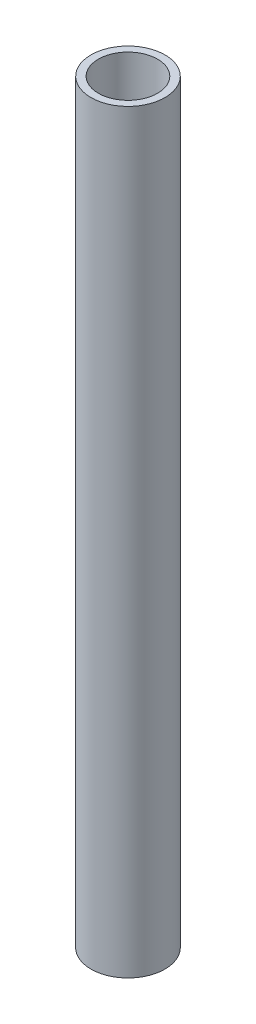
from build123d import *

# Parameters (mm, degrees)
SKETCH_1_R      = 5
SKETCH_1_R_2    = 4
EXTRUDE_1_DEPTH = 102


with BuildPart() as part:
    # Эскиз1 → Бобышка-Вытянуть1 (new body)
    with BuildSketch(Plane(origin=(0, 0, 0), x_dir=(1, 0, 0), z_dir=(0, 1, 0))):
        Circle(SKETCH_1_R)
        Circle(SKETCH_1_R_2, mode=Mode.SUBTRACT)
    extrude(amount=EXTRUDE_1_DEPTH)


solid = part.part
